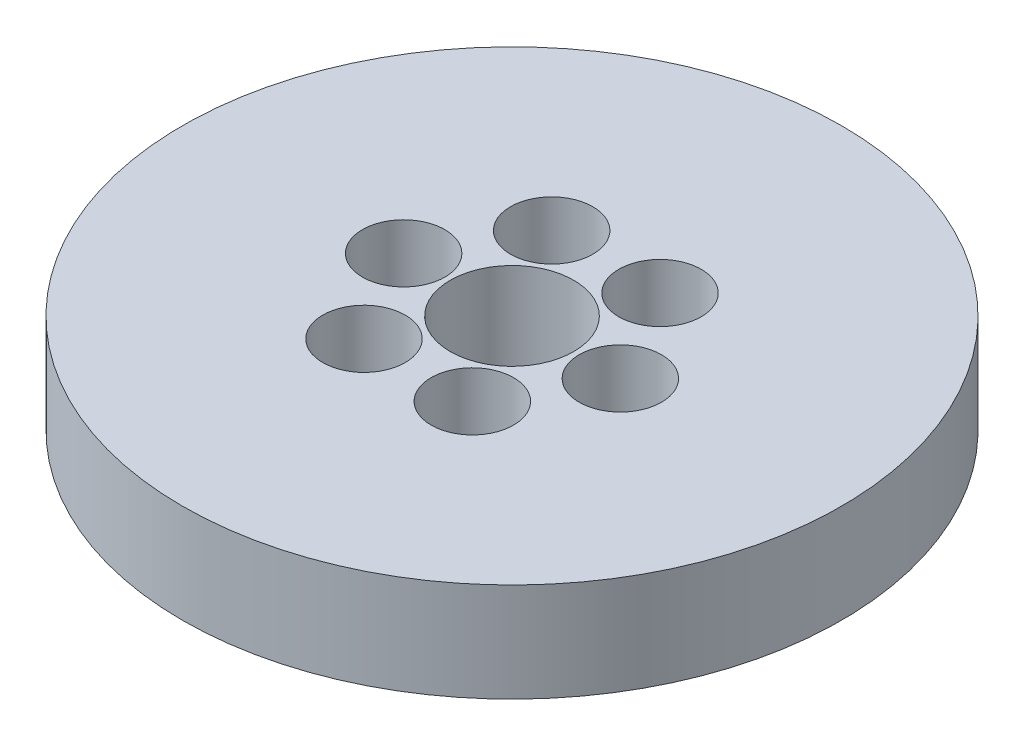
from build123d import *

# Parameters (mm, degrees)
SKETCH1_R           = 80
BOSS_EXTRUDE1_DEPTH = 24
SKETCH2_R           = 15
CUT_EXTRUDE1_DEPTH  = 116.654658358
SKETCH3_R           = 10
CUT_EXTRUDE2_DEPTH  = 14.521356602
CIRPATTERN1_COUNT   = 6


with BuildPart() as part:
    # Sketch1 → Boss-Extrude1 (new body)
    with BuildSketch(Plane(origin=(0, 0, 0), x_dir=(1, 0, 0), z_dir=(0, 1, 0))):
        Circle(SKETCH1_R)
    extrude(amount=BOSS_EXTRUDE1_DEPTH)

    # Sketch2 → Cut-Extrude1 (cut, through all)
    with BuildSketch(Plane(origin=(0, 0, 0), x_dir=(1, 0, 0), z_dir=(0, 1, 0))):
        Circle(SKETCH2_R)
    extrude(amount=CUT_EXTRUDE1_DEPTH, mode=Mode.SUBTRACT)

    # Sketch3 → Cut-Extrude2 (cut)
    with BuildSketch(Plane(origin=(0, 24, 0), x_dir=(1, 0, 0), z_dir=(0, 1, 0))):
        with Locations((-26.301158544, 0)):
            Circle(SKETCH3_R)
    cut_extrude2 = extrude(amount=-CUT_EXTRUDE2_DEPTH, mode=Mode.SUBTRACT)

    # CirPattern1: Cut-Extrude2 ×6 about axis
    cirpattern1_axis = Axis((0, 0, 0), (0, 1, 0))
    for i in range(1, CIRPATTERN1_COUNT):
        add(cut_extrude2.rotate(cirpattern1_axis, i * 360 / CIRPATTERN1_COUNT), mode=Mode.SUBTRACT)


solid = part.part
